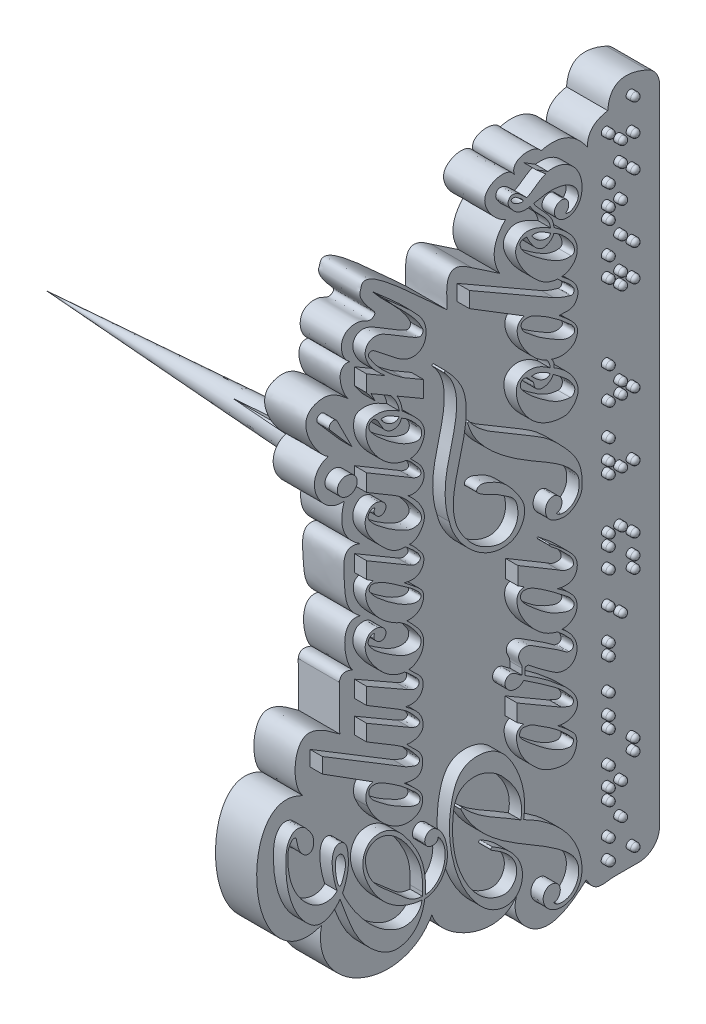
from build123d import *

# Parameters (mm, degrees)
SALIENTE_EXTRUIR2_DEPTH = 10
CORTAR_EXTRUIR1_DEPTH   = 141.50113099
CROQUIS5_RX             = 2.494776264
CROQUIS5_RY             = 2.162564658
SALIENTE_EXTRUIR3_DEPTH = 3
REDONDEO1_R             = 5
CROQUIS6_R              = 1
CROQUIS6_R_2            = 0.964072929
SALIENTE_EXTRUIR4_DEPTH = 2
REDONDEO2_R             = 0.9


with BuildPart() as part:
    # Croquis1 → Saliente-Extruir2 (new body)
    with BuildSketch(Plane.YZ):
        with BuildLine():
            Line((-82.644803295, -39.616041478), (-82.644803295, -50.4608464))
            Line((-82.644803295, -50.4608464), (81.390913247, -50.4608464))
            add(Edge.make_bspline(
                [(79.112679627, -37.887334346), (88.057990338, -38.615611944), (81.390913247, -50.4608464)],
                knots=[0, 0, 0, 1, 1, 1], degree=2))
            add(Edge.make_bspline(
                [(73.93771432, -32.938932182), (78.315794207, -32.933493174), (79.112679627, -37.887334346)],
                knots=[0, 0, 0, 1, 1, 1], degree=2))
            add(Edge.make_bspline(
                [(78.765086611, -21.726024385), (80.523803994, -28.350165455), (73.93771432, -32.938932182)],
                knots=[0, 0, 0, 1, 1, 1], degree=2))
            add(Edge.make_bspline(
                [(76.891946469, -15.280433308), (77.831036524, -14.90475999), (80.744878088, -15.427030243), (80.582437597, -20.589571644), (78.765086611, -21.726024385)],
                knots=[0.033422958, 0.033422958, 0.033422958, 0.033422958, 0.278906558, 1, 1, 1, 1], degree=3))
            add(Edge.make_bspline(
                [(68.678082118, -13.114016766), (69.381704581, -10.765136722), (75.473437831, -5.470496855), (79.073590292, -11.585310343), (78.232629186, -14.551405217), (76.891946469, -15.280433308)],
                knots=[0, 0, 0, 0, 0.533809886, 0.7593793, 0.979688772, 0.979688772, 0.979688772, 0.979688772], degree=3))
            add(Edge.make_bspline(
                [(58.024258387, -11.665002778), (63.926743781, -8.38634616), (68.678082118, -13.114016766)],
                knots=[0, 0, 0, 1, 1, 1], degree=2))
            Line((58.024258387, -11.665002778), (62.536415194, -4.977777268))
            add(Edge.make_bspline(
                [(56.821282934, 1.178760462), (59.424119549, 0.885336372), (68.466634263, 2.837578441), (62.536415194, -4.977777268)],
                knots=[0, 0, 0, 0, 1, 1, 1, 1], degree=3))
            add(Edge.make_bspline(
                [(57.642197805, 24.574203993), (58.564910608, 26.541632819), (64.414691172, 28.083051915), (65.474534565, 22.223747662), (63.470754247, 19.782671968), (64.793874912, 18.320168144), (66.360044444, 19.859895488), (69.557152039, 22.31258306), (71.000628198, 22.385209621), (71.715008577, 21.887921708), (76.703111675, 21.839215336), (57.38267557, 1.986730482), (56.821282934, 1.178760462)],
                knots=[0, 0, 0, 0, 0.22865966, 0.372766973, 0.461769751, 0.486323838, 0.53403408, 0.642402537, 0.758615164, 0.782831021, 0.884561112, 1, 1, 1, 1], degree=3))
            add(Edge.make_bspline(
                [(50.035249536, 25.024797896), (51.24517925, 26.466444064), (58.668353931, 28.991149977), (57.642197805, 24.574203993)],
                knots=[0, 0, 0, 0, 1, 1, 1, 1], degree=3))
            add(Edge.make_bspline(
                [(40.403908215, 29.917633263), (40.875847375, 31.781465146), (51.196718605, 39.010176033), (54.14276007, 29.637794143), (51.415174501, 26.740054005), (50.035249536, 25.024797896)],
                knots=[0, 0, 0, 0, 0.54701621, 0.715016523, 1, 1, 1, 1], degree=3))
            add(Edge.make_bspline(
                [(29.05506422, 26.072922848), (28.195127036, 31.760565181), (38.092287577, 36.932662613), (40.403908215, 29.917633263)],
                knots=[0, 0, 0, 0, 1, 1, 1, 1], degree=3))
            add(Edge.make_bspline(
                [(18.123116536, 22.117049567), (21.970176915, 28.28446548), (29.05506422, 26.072922848)],
                knots=[0, 0, 0, 1, 1, 1], degree=2))
            add(Edge.make_bspline(
                [(2.97566816, 22.117049567), (5.594219985, 25.840795536), (10.950754435, 25.803643162), (19.998115396, 26.667324524), (18.123116536, 22.117049567)],
                knots=[0, 0, 0, 0, 0.550537259, 1, 1, 1, 1], degree=3))
            add(Edge.make_bspline(
                [(-7.459260376, 24.031715354), (-5.479036756, 25.960438615), (4.669600043, 27.832747815), (2.97566816, 22.117049567)],
                knots=[0, 0, 0, 0, 1, 1, 1, 1], degree=3))
            add(Edge.make_bspline(
                [(-8.48441488, 27.230754731), (-6.186445977, 26.983265619), (-7.459260376, 24.031715354)],
                knots=[0, 0, 0, 1, 1, 1], degree=2))
            Line((-8.48441488, 27.230754731), (-19.379751367, 27.150319013))
            add(Edge.make_bspline(
                [(-27.882389681, 36.064675199), (-26.87452804, 37.040906566), (-21.992225334, 38.775291693), (-11.878482386, 36.522080197), (-18.224343165, 28.720921788), (-19.379751367, 27.150319013)],
                knots=[0.077094233, 0.077094233, 0.077094233, 0.077094233, 0.266164137, 0.614207306, 1, 1, 1, 1], degree=3))
            add(Edge.make_bspline(
                [(-57.318303844, 31.57511779), (-59.660343625, 37.380025457), (-50.670929259, 49.586206605), (-25.704244241, 47.536485851), (-26.642679671, 38.365618766), (-27.882389681, 36.064675199)],
                knots=[0, 0, 0, 0, 0.354827004, 0.843229357, 0.974583692, 0.974583692, 0.974583692, 0.974583692], degree=3))
            add(Edge.make_bspline(
                [(-57.318303844, 31.57511779), (-71.605295015, 34.512953916), (-81.578005408, 12.18779291), (-68.541134118, 4.791691125)],
                knots=[0, 0, 0, 0, 1, 1, 1, 1], degree=3))
            add(Edge.make_bspline(
                [(-68.541134118, 4.791691125), (-75.107673828, 2.958235432), (-82.462557591, -11.699903896), (-74.415357121, -15.989675807)],
                knots=[0, 0, 0, 0, 1, 1, 1, 1], degree=3))
            add(Edge.make_bspline(
                [(-74.415357121, -15.989675807), (-78.368849698, -14.005934117), (-87.893570794, -20.946057176), (-83.605571087, -28.659309912), (-79.917794735, -32.690135227)],
                knots=[0, 0, 0, 0, 0.492525232, 1, 1, 1, 1], degree=3))
            add(Edge.make_bspline(
                [(-79.917794735, -32.690135227), (-84.152824136, -34.881535191), (-82.644803295, -36.940698922), (-82.644803295, -39.616041478)],
                knots=[0, 0, 0, 0, 1, 1, 1, 1], degree=3))
        make_face()
    extrude(amount=SALIENTE_EXTRUIR2_DEPTH)

    # Croquis3 → Revolución1 (revolve)
    with BuildSketch(Plane.ZX.offset(-0.626945024)):
        Polygon((-11.665002778, 0), (-11.665002778, -100), (-5.665002778, 0), align=None)
    revolve(axis=Axis((0, -0.626945024, -11.665002778), (-1, 0, 0)))

    # Croquis4 → Cortar-Extruir1 (cut, through all)
    with BuildSketch(Plane(origin=(0, 0, 0), x_dir=(0, -1, 0), z_dir=(-1, 0, 0))):
        with BuildLine():
            Line((2.626945024, -17.321857027), (2.626945024, -13.665002778))
            Line((2.626945024, -13.665002778), (6.283799273, -13.665002778))
            ThreePointArc((6.283799273, -13.665002778), (4.869585711, -15.907643465), (2.626945024, -17.321857027))
        make_face()
        with BuildLine():
            Line((2.626945024, -6.008148528), (2.626945024, -9.665002778))
            Line((2.626945024, -9.665002778), (6.283799273, -9.665002778))
            ThreePointArc((6.283799273, -9.665002778), (4.869585711, -7.422362091), (2.626945024, -6.008148528))
        make_face()
        with BuildLine():
            Line((-1.373054976, -17.321857027), (-1.373054976, -13.665002778))
            Line((-1.373054976, -13.665002778), (-5.029909226, -13.665002778))
            ThreePointArc((-5.029909226, -13.665002778), (-3.615695663, -15.907643465), (-1.373054976, -17.321857027))
        make_face()
        with BuildLine():
            Line((-1.373054976, -6.008148528), (-1.373054976, -9.665002778))
            Line((-1.373054976, -9.665002778), (-5.029909226, -9.665002778))
            ThreePointArc((-5.029909226, -9.665002778), (-3.615695663, -7.422362091), (-1.373054976, -6.008148528))
        make_face()
    extrude(amount=CORTAR_EXTRUIR1_DEPTH, mode=Mode.SUBTRACT)

    # Croquis5 → Saliente-Extruir3 (add)
    # profile 1 of 9: a face of its own
    with BuildSketch(Plane.YZ.offset(10)):
        with Locations(Location((34.846843284, 28.332601043), (0, 0, 59.644295628))):
            Ellipse(CROQUIS5_RX, CROQUIS5_RY)
    # profile 2 of 9: a face of its own
    with BuildSketch(Plane.YZ.offset(10)):
        with BuildLine():
            Line((-30.497706307, 22.0410929), (-22.687780948, 34.378247684))
            Line((-22.687780948, 34.378247684), (-18.998784908, 34.378247684))
            Line((-18.998784908, 34.378247684), (-31.243112192, 14.206503376))
            add(Edge.make_bspline(
                [(-31.243112192, 14.206503376), (-31.495350477, 13.79095697), (-31.78046482, 12.824414388), (-32.380534398, 11.718420857), (-31.93997878, 10.715997927), (-31.011742933, 10.825491666), (-30.120200935, 11.573404961), (-28.02390287, 13.199131659), (-26.576148271, 14.855333875), (-25.670373492, 16.364958506)],
                knots=[0, 0, 0, 0, 0.125391882, 0.242084655, 0.298962532, 0.348525165, 0.442222819, 0.58819335, 1, 1, 1, 1], degree=3))
            Line((-25.670373492, 16.364958506), (-21.314218593, 23.625216671))
            Line((-21.314218593, 23.625216671), (-17.38975472, 23.625216671))
            Line((-17.38975472, 23.625216671), (-23.492296043, 13.14689813))
            add(Edge.make_bspline(
                [(-23.492296043, 13.14689813), (-23.709194259, 12.574873551), (-24.419922234, 11.748993625), (-23.711396026, 10.549508004), (-22.704430131, 11.070334517), (-20.833268788, 12.679925539), (-19.60177153, 13.727286494), (-18.260022215, 15.955299296)],
                knots=[0, 0, 0, 0, 0.194852855, 0.255549272, 0.32801945, 0.466069413, 1, 1, 1, 1], degree=3))
            Line((-18.260022215, 15.955299296), (-13.641060252, 23.625216671))
            Line((-13.641060252, 23.625216671), (-9.618093381, 23.625216671))
            Line((-9.618093381, 23.625216671), (-15.397904784, 13.483007356))
            add(Edge.make_bspline(
                [(-15.397904784, 13.483007356), (-15.632802368, 12.975963867), (-16.414408889, 11.849752088), (-15.438799291, 10.744805694), (-14.193984827, 11.115896775), (-12.956073494, 12.551207343), (-11.738337239, 13.604049866), (-11.195068735, 14.496009166)],
                knots=[0, 0, 0, 0, 0.25234893, 0.329617449, 0.447788217, 0.63904901, 1, 1, 1, 1], degree=3))
            add(Edge.make_bspline(
                [(-11.195068735, 14.496009166), (-11.125662358, 15.812887606), (-9.811063847, 18.799369933), (-6.291046383, 21.994014384), (-2.971777195, 23.938377405), (-0.761680135, 23.99547712), (0.152848159, 23.666337614), (1.064452528, 23.138362745), (1.437307684, 22.062885621), (1.462266794, 20.889925717), (0.866239543, 19.731265668), (0.033250535, 19.027722372), (-0.862524308, 18.899526658), (-1.728425228, 19.194985519), (-1.963550445, 20.255965684), (-1.256565159, 21.500243455), (-0.239431214, 22.215640374), (0.569327696, 21.649668078)],
                knots=[0, 0, 0, 0, 0.142885417, 0.345561827, 0.516919821, 0.5440803, 0.58436602, 0.62283742, 0.653405403, 0.704139129, 0.747462376, 0.792556118, 0.816847981, 0.844533108, 0.884115202, 0.91522998, 1, 1, 1, 1], degree=3))
            add(Edge.make_bspline(
                [(0.569327696, 21.649668078), (0.703885905, 22.173333667), (0.365145934, 23.047224893), (-0.873332324, 23.401697926), (-1.832397079, 22.734104907), (-3.164927941, 21.657374015), (-4.517845701, 19.854084499), (-6.14767733, 17.388414673), (-7.656944751, 14.917191894), (-8.250930214, 12.62010045), (-8.080206377, 10.6436884), (-6.226916701, 10.219628161), (-3.516466158, 12.025935037), (-1.468106793, 13.629987398), (-0.308113366, 15.512058678)],
                knots=[0, 0, 0, 0, 0.059858486, 0.084589238, 0.133112302, 0.178045114, 0.27869413, 0.378635457, 0.509425428, 0.593264141, 0.648482215, 0.700591929, 0.767969696, 1, 1, 1, 1], degree=3))
            add(Edge.make_bspline(
                [(-0.308113366, 15.512058678), (0.482389719, 17.271679063), (2.303957452, 20.015408618), (5.683196223, 22.691678255), (8.980556338, 24.078713978), (11.574226001, 23.924686296), (11.769595142, 22.0410929)],
                knots=[0, 0, 0, 0, 0.349520857, 0.588758676, 0.76777847, 1, 1, 1, 1], degree=3))
            Line((11.769595142, 22.0410929), (12.818282573, 23.625216671))
            Line((12.818282573, 23.625216671), (16.773332314, 23.625216671))
            Line((16.773332314, 23.625216671), (10.601057719, 13.14689813))
            add(Edge.make_bspline(
                [(10.601057719, 13.14689813), (10.403309376, 12.811192047), (9.854874697, 11.835880973), (10.466731922, 10.293676131), (11.907841206, 10.947491622), (13.245425571, 12.19234149), (14.370663516, 13.379217003), (15.013539455, 14.206503376)],
                knots=[0, 0, 0, 0, 0.18998974, 0.314253281, 0.46099557, 0.619369845, 1, 1, 1, 1], degree=3))
            add(Edge.make_bspline(
                [(15.013539455, 14.206503376), (14.861501424, 16.752595789), (17.513295191, 19.693311512), (21.04066715, 22.782156934), (23.933753673, 24.147587322), (26.481374878, 23.897348737), (27.953093696, 22.307998455), (27.723040651, 20.388237857), (26.744310064, 18.914610068), (24.875111847, 18.882332173), (24.322592807, 20.397600203), (25.23436895, 21.615835783), (26.262273059, 22.094216138), (26.881404862, 21.559220676)],
                knots=[0, 0, 0, 0, 0.257469456, 0.404494229, 0.516094308, 0.593903676, 0.669354812, 0.720453638, 0.795977604, 0.83917126, 0.895118555, 0.925933874, 1, 1, 1, 1], degree=3))
            add(Edge.make_bspline(
                [(26.881404862, 21.559220676), (27.095434819, 22.024707408), (26.903598025, 22.929151083), (25.595701402, 23.462917239), (24.34128487, 22.587136012), (23.172170991, 21.441882357), (21.057192441, 18.744302023), (18.990864201, 15.657862613), (17.652008916, 12.210035503), (18.504955327, 10.197354175), (20.099824322, 10.389866914), (21.242953044, 11.100089923), (23.800625982, 13.016208038), (25.938452498, 14.890218682), (27.017893445, 16.711662617)],
                knots=[0, 0, 0, 0, 0.049092218, 0.083265275, 0.127240511, 0.194236149, 0.257103548, 0.479655366, 0.581588916, 0.628504236, 0.66870028, 0.725490084, 0.77063452, 1, 1, 1, 1], degree=3))
            Line((27.017893445, 16.711662617), (31.115067776, 23.625216671))
            Line((31.115067776, 23.625216671), (35.257266001, 23.625216671))
            Line((35.257266001, 23.625216671), (28.696050361, 12.553850085))
            add(Edge.make_bspline(
                [(28.696050361, 12.553850085), (28.421001775, 12.38558581), (27.688811429, 10.302584809), (29.534538965, 10.561449842), (30.964216072, 11.881738568), (32.432103988, 12.9727037), (33.069573852, 14.025882844)],
                knots=[0, 0, 0, 0, 0.260800607, 0.352343484, 0.552856667, 1, 1, 1, 1], degree=3))
            add(Edge.make_bspline(
                [(33.069573852, 14.025882844), (33.409827481, 16.992613594), (36.389951401, 20.872947406), (41.20957219, 23.598047558), (44.131573279, 23.908158354), (46.010391398, 23.411691703), (46.752605622, 19.960019902), (45.511796067, 17.692317483), (44.307537822, 15.695233012)],
                knots=[0, 0, 0, 0, 0.340661798, 0.543870138, 0.625452295, 0.689244272, 0.744404401, 1, 1, 1, 1], degree=3))
            add(Edge.make_bspline(
                [(44.307537822, 15.695233012), (46.739800731, 16.14062036), (48.596886104, 17.817680667)],
                knots=[0, 0, 0, 1, 1, 1], degree=2))
            Line((48.596886104, 17.817680667), (51.37039432, 22.592218674))
            Line((51.37039432, 22.592218674), (49.327409213, 21.559220676))
            Line((49.327409213, 21.559220676), (52.08179092, 23.625216671))
            Line((52.08179092, 23.625216671), (56.040074566, 23.625216671))
            Line((56.040074566, 23.625216671), (53.377765451, 19.042105657))
            add(Edge.make_bspline(
                [(53.377765451, 19.042105657), (54.917231198, 20.83701878), (57.097396288, 23.246568199), (60.849365024, 24.232211253), (62.812996414, 23.15197918), (63.059472624, 20.708912494), (61.646210479, 18.233281197), (59.944700362, 15.468199939), (58.458594129, 13.043884123), (57.614839954, 11.47508115), (57.201618374, 10.151887113), (58.379948137, 9.767346828), (58.757349247, 10.061457871)],
                knots=[0, 0, 0, 0, 0.271834595, 0.349441849, 0.418952217, 0.493831227, 0.597398699, 0.73563194, 0.864555428, 0.912431867, 0.945486453, 1, 1, 1, 1], degree=3))
            add(Edge.make_bspline(
                [(58.757349247, 10.061457871), (63.129690422, 12.126338427), (65.890042563, 16.349596698), (69.639244247, 19.24270502)],
                knots=[0, 0, 0, 0, 1, 1, 1, 1], degree=3))
            add(Edge.make_bspline(
                [(50.784198361, 14.696456585), (52.083335439, 16.665281832), (54.754997349, 19.863668839), (57.583549019, 22.009907803), (59.867790785, 23.622580383), (60.343395815, 22.546045741), (59.983709006, 21.657106373), (58.89108044, 20.410563913), (56.886609035, 17.632506907), (54.337885956, 15.031926684), (53.850630468, 11.798154204), (55.041008394, 9.290230184), (59.260948676, 8.825606098), (64.385462227, 12.744249261), (67.265776169, 16.731441217), (69.639244247, 19.24270502)],
                knots=[0, 0, 0, 0, 0.165295197, 0.229847239, 0.273783251, 0.283531385, 0.295769431, 0.332828834, 0.390387274, 0.517595279, 0.555803585, 0.593627198, 0.683261048, 0.778170359, 1, 1, 1, 1], degree=3))
            Line((50.784198361, 14.696456585), (47.926779005, 9.777467258))
            Line((47.926779005, 9.777467258), (43.92636135, 9.777467258))
            Line((43.92636135, 9.777467258), (47.70798914, 16.287462615))
            add(Edge.make_bspline(
                [(43.92636135, 15.001683932), (45.979958164, 15.159350298), (47.70798914, 16.287462615)],
                knots=[0, 0, 0, 1, 1, 1], degree=2))
            add(Edge.make_bspline(
                [(32.955522845, 13.064949631), (32.853955645, 10.948475602), (38.411901674, 7.341171787), (42.317267568, 13.415106695), (43.92636135, 15.001683932)],
                knots=[0, 0, 0, 0, 0.387764521, 1, 1, 1, 1], degree=3))
            add(Edge.make_bspline(
                [(25.519528041, 13.710651274), (24.828449868, 12.537129382), (25.525168279, 9.786549722), (29.909740771, 9.481667437), (31.67224914, 11.884750717), (32.955522845, 13.064949631)],
                knots=[0, 0, 0, 0, 0.341873527, 0.528237882, 1, 1, 1, 1], degree=3))
            add(Edge.make_bspline(
                [(15.013539455, 13.311144091), (14.91429186, 11.925781845), (16.343656626, 10.332155077), (18.912958232, 9.383184268), (22.250934954, 10.368843224), (24.204621252, 12.246617966), (25.519528041, 13.710651274)],
                knots=[0, 0, 0, 0, 0.276982541, 0.422942082, 0.57202269, 1, 1, 1, 1], degree=3))
            add(Edge.make_bspline(
                [(7.561671932, 14.496009166), (7.267676701, 13.48275104), (6.912069425, 11.098654317), (9.182991117, 9.734650211), (11.078164452, 9.68719222), (12.952699416, 11.230951911), (14.311638939, 12.309064024), (15.013539455, 13.311144091)],
                knots=[0, 0, 0, 0, 0.28826711, 0.445397221, 0.571943816, 0.717435638, 1, 1, 1, 1], degree=3))
            add(Edge.make_bspline(
                [(-0.694878283, 13.902170657), (-0.934340159, 12.794224493), (-0.452231084, 10.765849124), (1.618946089, 9.7936436), (2.847764132, 9.749983221), (3.862615372, 10.149224275), (5.493022345, 11.666220656), (6.537569955, 13.349788418), (7.561671932, 14.496009166)],
                knots=[0, 0, 0, 0, 0.26750859, 0.402148969, 0.498610503, 0.541616972, 0.649788603, 1, 1, 1, 1], degree=3))
            add(Edge.make_bspline(
                [(-11.195068735, 13.311144091), (-11.178625535, 12.614098786), (-10.610030803, 11.404395217), (-9.266733899, 10.200024497), (-7.742074453, 9.763986285), (-4.407040998, 9.78892671), (-2.238831965, 12.469594053), (-0.694878283, 13.902170657)],
                knots=[0, 0, 0, 0, 0.148996016, 0.285512453, 0.380610203, 0.491113446, 1, 1, 1, 1], degree=3))
            add(Edge.make_bspline(
                [(-18.651058208, 14.206503376), (-18.89847325, 13.208950869), (-18.943961216, 11.197959644), (-16.906331206, 9.846097911), (-13.827040536, 9.880954987), (-12.461609436, 12.402679974), (-11.195068735, 13.311144091)],
                knots=[0, 0, 0, 0, 0.281685785, 0.41294428, 0.576334414, 1, 1, 1, 1], degree=3))
            add(Edge.make_bspline(
                [(-26.669974615, 13.902170657), (-26.951551347, 12.907685136), (-26.614477477, 9.793952995), (-21.737710067, 9.959672558), (-19.92790384, 12.554520228), (-18.651058208, 14.206503376)],
                knots=[0, 0, 0, 0, 0.313935981, 0.487109169, 1, 1, 1, 1], degree=3))
            add(Edge.make_bspline(
                [(-34.612788223, 14.406680678), (-34.749578709, 13.498311973), (-35.462920373, 10.853012022), (-32.831918615, 9.913102922), (-29.639536103, 10.176666048), (-28.068462248, 12.824410423), (-26.669974615, 13.902170657)],
                knots=[0, 0, 0, 0, 0.278767773, 0.418047709, 0.56300297, 1, 1, 1, 1], degree=3))
            add(Edge.make_bspline(
                [(-41.665402261, 18.06000394), (-42.398649629, 16.939800513), (-43.38983181, 15.00218828), (-43.245492069, 12.154322453), (-41.878669651, 10.056375276), (-39.162522446, 9.858245633), (-36.854296577, 11.850247578), (-35.525473694, 13.391655238), (-34.612788223, 14.406680678)],
                knots=[0, 0, 0, 0, 0.236613525, 0.362100544, 0.48321998, 0.639456455, 0.763525568, 1, 1, 1, 1], degree=3))
            add(Edge.make_bspline(
                [(-41.665402261, 18.06000394), (-38.976789167, 21.692281799), (-34.885731766, 23.433851877)],
                knots=[0, 0, 0, 1, 1, 1], degree=2))
            add(Edge.make_bspline(
                [(-34.885731766, 23.433851877), (-34.090598621, 23.751499954), (-32.311132142, 24.056793618), (-30.572042521, 23.183195618), (-30.497706307, 22.0410929)],
                knots=[0, 0, 0, 0, 0.485787736, 1, 1, 1, 1], degree=3))
        make_face()
        with BuildLine():
            add(Edge.make_bspline(
                [(-40.447564124, 12.172364936), (-40.18129702, 13.179955863), (-39.14482847, 14.93934801), (-37.666461097, 17.851893592), (-35.432747972, 20.608407645), (-33.731351433, 23.132126269), (-31.751757451, 23.100654241), (-31.282712559, 22.56918234), (-31.085075052, 21.370533187), (-31.886399111, 19.548776174), (-33.392033254, 17.233904327), (-35.082362201, 14.748183847), (-37.09405979, 12.605250295), (-38.464665179, 10.999519338), (-39.814486027, 10.524672569), (-40.694613408, 10.960918218), (-40.576500257, 11.684453077), (-40.447564124, 12.172364936)],
                knots=[0, 0, 0, 0, 0.085966306, 0.206460373, 0.292539348, 0.428730708, 0.447980431, 0.464095345, 0.4900801, 0.557009165, 0.641477484, 0.750478217, 0.835345127, 0.916018946, 0.945475368, 0.958372015, 1, 1, 1, 1], degree=3))
        make_face(mode=Mode.SUBTRACT)
        with BuildLine():
            add(Edge.make_bspline(
                [(10.933520233, 21.260937611), (11.026943852, 21.510852075), (11.185293923, 21.982797903), (11.088155124, 22.782409299), (10.294540528, 23.139165812), (9.566572567, 22.736511922), (8.208035994, 21.70060739), (6.129496236, 19.288265116), (3.766195356, 16.04441155), (2.279766755, 13.07196994), (1.911891265, 11.198784452), (2.438533315, 10.378860583), (3.296005178, 10.44245619), (3.984188127, 11.050238741), (4.595548889, 11.722516623), (5.591897927, 12.741557684), (7.646231694, 15.924145112), (10.011124132, 18.793465993), (10.933520233, 21.260937611)],
                knots=[0, 0, 0, 0, 0.025213843, 0.046911913, 0.068040733, 0.094659768, 0.119728721, 0.230589651, 0.389513283, 0.497031106, 0.541805392, 0.563227914, 0.573881123, 0.617524423, 0.644483831, 0.660275178, 0.751057055, 1, 1, 1, 1], degree=3))
        make_face(mode=Mode.SUBTRACT)
        with BuildLine():
            add(Edge.make_bspline(
                [(43.064694075, 15.695233012), (43.705202044, 17.043104096), (45.147793787, 18.494536691), (44.801862268, 20.168439644)],
                knots=[0, 0, 0, 0, 1, 1, 1, 1], degree=3))
            add(Edge.make_bspline(
                [(44.801862268, 20.168439644), (44.054757212, 19.801378341), (42.798120456, 18.519016329), (42.178396667, 16.511825406), (43.064694075, 15.695233012)],
                knots=[0, 0, 0, 0, 0.443860442, 1, 1, 1, 1], degree=3))
        make_face(mode=Mode.SUBTRACT)
        with BuildLine():
            add(Edge.make_bspline(
                [(42.524103437, 15.18353356), (41.106910436, 15.487936036), (40.676057715, 17.841216537), (42.90403015, 20.119343708), (44.713605701, 20.646318096), (45.538393761, 21.649668078)],
                knots=[0, 0, 0, 0, 0.390263784, 0.598106042, 1, 1, 1, 1], degree=3))
            add(Edge.make_bspline(
                [(45.538393761, 21.649668078), (45.687915256, 22.052098007), (45.509388179, 22.833550146), (44.216615328, 23.281393493), (42.867983039, 22.329081693), (40.579870517, 20.161261894), (38.0541568, 16.814292594), (36.218293317, 13.665329329), (35.457692022, 10.211337619), (37.734633049, 10.213137819), (39.96404805, 11.849917195), (41.635297917, 13.510948417), (42.524103437, 15.18353356)],
                knots=[0, 0, 0, 0, 0.048158976, 0.074574605, 0.142627086, 0.215099305, 0.445178577, 0.592364676, 0.678170068, 0.744904986, 0.783215905, 1, 1, 1, 1], degree=3))
        make_face(mode=Mode.SUBTRACT)
    # profile 3 of 9: a face of its own
    with BuildSketch(Plane.YZ.offset(10)):
        with BuildLine():
            Line((-36.589142617, -14.473064038), (-35.530540616, -12.904764777))
            Line((-35.530540616, -12.904764777), (-31.394151315, -12.904764777))
            Line((-31.394151315, -12.904764777), (-37.667348359, -23.686822196))
            add(Edge.make_bspline(
                [(-37.667348359, -23.686822196), (-37.541190488, -23.883626797), (-39.212442592, -26.153133263), (-37.725537473, -26.65675328), (-36.754460843, -26.251167565), (-35.267603298, -24.922469019), (-33.190929851, -22.906433336), (-30.544177434, -18.998088893), (-28.964553076, -16.92825523), (-27.42825413, -14.473064038)],
                knots=[0, 0, 0, 0, 0.14525193, 0.175575069, 0.204105069, 0.303646465, 0.478715982, 0.653344411, 1, 1, 1, 1], degree=3))
            add(Edge.make_bspline(
                [(-27.42825413, -14.473064038), (-27.949733257, -14.07647141), (-28.462528668, -12.955697255), (-28.055160164, -11.155885197), (-26.870971735, -10.01510621), (-25.352193168, -9.821781298), (-24.402536135, -10.743334805), (-24.557902066, -11.893839044), (-25.284864236, -12.919550549), (-25.869138437, -13.612721811), (-26.155415148, -14.114735935)],
                knots=[0, 0, 0, 0, 0.168279773, 0.299868444, 0.462898237, 0.570080625, 0.670079551, 0.761042164, 0.848906487, 1, 1, 1, 1], degree=3))
            Line((-26.155415148, -14.114735935), (-24.696137457, -14.114735935))
            add(Edge.make_bspline(
                [(-24.696137457, -14.114735935), (-23.78203047, -14.110158411), (-22.860187076, -13.123902106), (-20.822720068, -13.314740071), (-20.320673596, -15.196047406), (-21.481186737, -17.131276785), (-23.519173304, -20.090566217), (-25.186564446, -23.049823123), (-27.005579737, -25.216448441), (-26.682205791, -26.69905747), (-24.846058273, -26.393381504), (-23.314659625, -24.855582792), (-21.96912491, -23.512615862), (-21.314218593, -22.675786924)],
                knots=[0, 0, 0, 0, 0.100494216, 0.148461896, 0.209389559, 0.289545911, 0.40953298, 0.637589615, 0.695543286, 0.734759354, 0.779003548, 0.87302752, 1, 1, 1, 1], degree=3))
            add(Edge.make_bspline(
                [(-21.314218593, -22.675786924), (-20.662718094, -19.74721257), (-17.729032764, -16.352078884), (-13.38279486, -13.64508377), (-10.204239491, -12.635955653), (-7.921858441, -12.910678267), (-7.873240841, -14.671315572)],
                knots=[0, 0, 0, 0, 0.462898307, 0.689315778, 0.804550276, 1, 1, 1, 1], degree=3))
            Line((-7.873240841, -14.671315572), (-6.825426111, -13.047202742))
            Line((-6.825426111, -13.047202742), (-2.564312878, -13.047202742))
            Line((-2.564312878, -13.047202742), (-8.523103919, -23.059368665))
            add(Edge.make_bspline(
                [(-8.523103919, -23.059368665), (-9.113764747, -23.907907811), (-9.764832497, -25.079563624), (-9.283466593, -26.61865014), (-8.359175348, -26.55060604), (-7.6741872, -26.252401621), (-6.711400797, -25.606922583), (-5.829417747, -24.550550046), (-4.475199698, -23.367917875), (-3.431711699, -22.156339789), (-2.727787436, -21.09912143), (-2.237647188, -20.801852808)],
                knots=[0, 0, 0, 0, 0.244457244, 0.274609225, 0.337331503, 0.412324183, 0.497476135, 0.582172537, 0.73631932, 0.868933802, 1, 1, 1, 1], degree=3))
            add(Edge.make_bspline(
                [(-2.237647188, -20.801852808), (-2.157651198, -20.753335475), (-2.050003553, -20.709749878), (-1.940536131, -20.877484589), (-2.016763136, -20.977203469)],
                knots=[0, 0, 0, 0, 0.447969714, 1, 1, 1, 1], degree=3))
            add(Edge.make_bspline(
                [(-12.283196994, -22.675786924), (-12.52744865, -23.721936247), (-13.008019338, -26.389432927), (-10.097803732, -27.747888735), (-7.540451292, -27.116252742), (-5.443855141, -25.071433504), (-3.584529966, -22.973522383), (-2.458703448, -21.555342317), (-2.016763136, -20.977203469)],
                knots=[0, 0, 0, 0, 0.227561632, 0.360002103, 0.497208089, 0.676097305, 0.870838032, 1, 1, 1, 1], degree=3))
            add(Edge.make_bspline(
                [(-21.314218593, -23.686822196), (-21.456986689, -24.908478157), (-20.416576355, -27.444173334), (-17.111684702, -27.566500486), (-14.456457303, -25.759622556), (-13.189579667, -24.04932219), (-12.283196994, -22.675786924)],
                knots=[0, 0, 0, 0, 0.287522083, 0.498789886, 0.650604314, 1, 1, 1, 1], degree=3))
            add(Edge.make_bspline(
                [(-24.81525406, -15.672488767), (-26.060219591, -17.090042713), (-27.872930685, -19.823307792), (-30.66885256, -23.331281046), (-29.979567981, -26.457421917), (-26.152314548, -28.607888661), (-22.540504943, -25.48937093), (-21.314218593, -23.686822196)],
                knots=[0, 0, 0, 0, 0.247621329, 0.466641638, 0.549743373, 0.643825708, 1, 1, 1, 1], degree=3))
            add(Edge.make_bspline(
                [(-25.060829882, -14.760903798), (-24.670997452, -14.760903798), (-24.718820119, -15.644128314), (-24.81525406, -15.672488767)],
                knots=[0, 0, 0, 0, 1, 1, 1, 1], degree=3))
            Line((-25.060829882, -14.760903798), (-26.545208314, -14.760903798))
            add(Edge.make_bspline(
                [(-32.783090485, -23.309419323), (-30.389643163, -20.70670642), (-28.382832279, -17.773119621), (-26.545208314, -14.760903798)],
                knots=[0, 0, 0, 0, 1, 1, 1, 1], degree=3))
            add(Edge.make_bspline(
                [(-41.027553368, -22.675786924), (-41.625501514, -23.910000001), (-41.220899702, -27.521338633), (-36.699337674, -27.814866835), (-33.489396872, -24.289216747), (-32.783090485, -23.309419323)],
                knots=[0, 0, 0, 0, 0.339105449, 0.559776115, 1, 1, 1, 1], degree=3))
            add(Edge.make_bspline(
                [(-46.670259924, -16.916089347), (-48.519142541, -18.691307093), (-49.914492909, -21.40140644), (-50.282880918, -26.038716892), (-47.773762667, -27.470856673), (-45.250454965, -27.456025326), (-43.155012447, -25.206532006), (-41.828283406, -23.805264459), (-41.027553368, -22.675786924)],
                knots=[0, 0, 0, 0, 0.336873126, 0.480562729, 0.576285296, 0.713907814, 0.806228155, 1, 1, 1, 1], degree=3))
            add(Edge.make_bspline(
                [(-46.670259924, -16.916089347), (-44.732122721, -14.896395878), (-41.623506711, -12.729377856), (-36.876007668, -12.522450193), (-36.589142617, -14.473064038)],
                knots=[0, 0, 0, 0, 0.651483923, 1, 1, 1, 1], degree=3))
        make_face()
        with BuildLine():
            add(Edge.make_bspline(
                [(-46.978820231, -25.249744012), (-46.805118283, -24.203334809), (-45.664824752, -21.415236997), (-42.894653506, -17.876101562), (-40.541550301, -14.986812095), (-38.666338389, -13.143007551), (-37.171421755, -13.927612398), (-37.429529282, -15.137891914), (-37.591059372, -16.422419201), (-38.923578302, -18.157975502), (-40.303182966, -20.594541312), (-42.501986631, -23.479403797), (-44.345137661, -25.387036228), (-46.007224424, -26.826929376), (-47.09654746, -26.173694117), (-47.025192657, -25.529099162), (-46.978820231, -25.249744012)],
                knots=[0, 0, 0, 0, 0.090530315, 0.274154443, 0.387080475, 0.44561956, 0.476897129, 0.505931909, 0.544194431, 0.59498319, 0.694927298, 0.798763293, 0.913403487, 0.945966019, 0.97583153, 1, 1, 1, 1], degree=3))
        make_face(mode=Mode.SUBTRACT)
        with BuildLine():
            add(Edge.make_bspline(
                [(-17.944750921, -24.175669534), (-17.497455223, -22.9786373), (-16.491157201, -20.705970045), (-14.228574058, -17.825932415), (-12.1707091, -15.421444038), (-10.586479042, -13.881737303), (-9.233583139, -13.586303983), (-8.620931552, -14.11766229), (-8.50559312, -15.202747719), (-9.187393392, -17.020671897), (-10.644525774, -19.105221558), (-12.320774632, -21.545179426), (-14.282044728, -24.003382794), (-15.804053235, -26.149175019), (-17.529428031, -26.825068213), (-18.118533344, -26.536711294), (-18.444313588, -25.580590052), (-18.17397857, -24.789118057), (-17.944750921, -24.175669534)],
                knots=[0, 0, 0, 0, 0.11090409, 0.224900591, 0.32275164, 0.396740853, 0.416178397, 0.439155655, 0.458588129, 0.510413627, 0.607683339, 0.686284643, 0.77421757, 0.890306213, 0.914591937, 0.928991008, 0.943164479, 1, 1, 1, 1], degree=3))
        make_face(mode=Mode.SUBTRACT)
    # profile 4 of 9: a face of its own
    with BuildSketch(Plane.YZ.offset(10)):
        with BuildLine():
            Line((49.064493096, -14.671315572), (57.290510702, -1.311163425))
            Line((57.290510702, -1.311163425), (61.100100823, -1.311163425))
            Line((61.100100823, -1.311163425), (49.327409213, -21.808781068))
            add(Edge.make_bspline(
                [(49.327409213, -21.808781068), (48.339098786, -23.700659474), (47.811733476, -25.757381001)],
                knots=[0, 0, 0, 1, 1, 1], degree=2))
            add(Edge.make_bspline(
                [(47.811733476, -25.757381001), (47.46771167, -26.448910509), (48.408088409, -26.953251647), (50.577765857, -25.711479158), (51.573342996, -23.855203115), (52.83297246, -22.675786924)],
                knots=[0, 0, 0, 0, 0.217033476, 0.277261483, 1, 1, 1, 1], degree=3))
            add(Edge.make_bspline(
                [(52.83297246, -22.675786924), (52.925264203, -20.11194608), (55.861769188, -16.55570042), (60.152371491, -13.393175886), (64.429103777, -11.931509576), (66.51904784, -14.189520628), (66.547367186, -17.375073345), (65.240390632, -19.39418659), (64.442769926, -20.977203469)],
                knots=[0, 0, 0, 0, 0.28484034, 0.494618585, 0.639607744, 0.741193806, 0.790470443, 1, 1, 1, 1], degree=3))
            add(Edge.make_bspline(
                [(64.442769926, -20.977203469), (67.445017457, -20.679343318), (68.832483189, -17.219234634), (71.404194247, -16.085406747)],
                knots=[0, 0, 0, 0, 1, 1, 1, 1], degree=3))
            add(Edge.make_bspline(
                [(71.404194247, -16.085406747), (71.133602513, -14.995691315), (71.368853976, -12.90344372), (73.20225775, -11.427487765), (74.614971385, -10.422548925), (76.052300761, -11.119275511), (75.949195908, -13.319566802), (74.387679505, -14.288436426), (73.662809556, -15.240915162)],
                knots=[0, 0, 0, 0, 0.266847528, 0.419625993, 0.539160831, 0.639185141, 0.706232267, 1, 1, 1, 1], degree=3))
            add(Edge.make_bspline(
                [(73.662809556, -15.240915162), (74.325660994, -16.904871781), (75.794769594, -18.093680135), (76.343193456, -19.832025065)],
                knots=[0, 0, 0, 0, 1, 1, 1, 1], degree=3))
            Line((76.343193456, -19.832025065), (78.356931487, -17.517658141))
            Line((78.356931487, -17.517658141), (76.608626298, -20.337353759))
            add(Edge.make_bspline(
                [(65.854104068, -24.779293655), (66.056473004, -25.20773205), (66.993298898, -25.560028648), (68.515647078, -25.191374475), (69.141233338, -23.684312269), (68.55987468, -22.391883657), (67.309944498, -21.700814998), (65.841847113, -22.294411805), (64.59594539, -23.664430421), (64.308006902, -26.08648017), (66.258692734, -28.315810012), (72.363384217, -29.411954971), (77.307822072, -25.284155519), (76.608626298, -20.337353759)],
                knots=[0, 0, 0, 0, 0.045053215, 0.090751648, 0.144418817, 0.182812034, 0.224475013, 0.273595313, 0.327678816, 0.406288058, 0.49277959, 0.596484506, 1, 1, 1, 1], degree=3))
            add(Edge.make_bspline(
                [(71.591354449, -16.916089347), (71.867996361, -18.162302092), (72.557545564, -21.342890082), (71.650185388, -25.939034631), (68.815914758, -27.728202305), (67.18499016, -27.849065773), (66.219415107, -27.033225412), (65.566987993, -26.217738909), (65.343078138, -25.409645012), (65.614550325, -24.531533675), (65.854104068, -24.779293655)],
                knots=[0, 0, 0, 0, 0.2158676, 0.586054762, 0.684876877, 0.784597528, 0.839918776, 0.897923489, 0.958698331, 1, 1, 1, 1], degree=3))
            add(Edge.make_bspline(
                [(64.094882406, -21.808781068), (67.303598452, -21.732758977), (69.073586627, -18.303974707), (71.591354449, -16.916089347)],
                knots=[0, 0, 0, 0, 1, 1, 1, 1], degree=3))
            add(Edge.make_bspline(
                [(52.83297246, -23.686822196), (52.844999346, -25.163120718), (54.364065578, -27.458626442), (59.861477705, -27.652119084), (62.578732259, -23.897720698), (64.094882406, -21.808781068)],
                knots=[0, 0, 0, 0, 0.288019607, 0.431178397, 1, 1, 1, 1], degree=3))
            add(Edge.make_bspline(
                [(44.977524237, -23.059368665), (44.958620581, -24.087157084), (44.441190253, -26.406158492), (46.880162118, -27.815262847), (50.1201209, -27.362088516), (51.722827371, -24.984367136), (52.83297246, -23.686822196)],
                knots=[0, 0, 0, 0, 0.27188574, 0.426640437, 0.570583027, 1, 1, 1, 1], degree=3))
            add(Edge.make_bspline(
                [(36.712930337, -21.221320049), (36.222926012, -22.406170454), (35.966301906, -24.362577782), (37.036622457, -26.688565714), (38.56324193, -27.576184324), (40.362680666, -27.592963397), (42.662432828, -26.009862561), (43.93417689, -24.249546015), (44.977524237, -23.059368665)],
                knots=[0, 0, 0, 0, 0.251228857, 0.359926586, 0.479127162, 0.572937462, 0.694875113, 1, 1, 1, 1], degree=3))
            add(Edge.make_bspline(
                [(34.617878492, -21.808781068), (35.830347239, -22.02459899), (36.712930337, -21.221320049)],
                knots=[0, 0, 0, 1, 1, 1], degree=2))
            add(Edge.make_bspline(
                [(23.169427538, -24.779293655), (23.632207201, -26.298207506), (25.939704349, -28.206117155), (30.889310536, -26.714271628), (33.277031639, -24.096837133), (34.617878492, -21.808781068)],
                knots=[0, 0, 0, 0, 0.327278207, 0.464117917, 1, 1, 1, 1], degree=3))
            add(Edge.make_bspline(
                [(23.169427538, -24.779293655), (23.033575958, -22.280398854), (24.422028529, -17.399156908), (29.421948578, -13.763081236), (33.230798172, -12.602074837), (35.846219612, -12.714809085), (38.058076433, -16.095183803), (36.24998595, -19.308084647), (35.045406439, -20.882686873)],
                knots=[0, 0, 0, 0, 0.264379004, 0.508658658, 0.615544944, 0.692031587, 0.763499805, 1, 1, 1, 1], degree=3))
            add(Edge.make_bspline(
                [(35.045406439, -20.882686873), (36.219294034, -20.879956768), (37.143364299, -20.059659713)],
                knots=[0, 0, 0, 1, 1, 1], degree=2))
            add(Edge.make_bspline(
                [(37.143364299, -20.059659713), (38.03205242, -17.942952491), (40.649695233, -15.406752815), (45.011576885, -12.889228741), (48.49529945, -12.499868937), (49.064493096, -14.671315572)],
                knots=[0, 0, 0, 0, 0.438047767, 0.676242914, 1, 1, 1, 1], degree=3))
        make_face()
        with BuildLine():
            add(Edge.make_bspline(
                [(39.218213717, -26.220402555), (38.997043826, -25.337115062), (39.519861414, -23.528504416), (40.948741654, -21.335321596), (42.471194377, -18.518718524), (44.44511767, -16.175052195), (46.019918659, -14.155120794), (48.038892866, -13.603912346), (48.584146057, -15.789338287), (47.682547827, -17.569511885), (45.605891227, -21.188688531), (43.220541681, -24.305177354), (40.851644209, -26.757820353), (39.47365355, -26.982611634), (39.266101278, -26.411651386), (39.218213717, -26.220402555)],
                knots=[0, 0, 0, 0, 0.077906853, 0.163792135, 0.23976646, 0.369498324, 0.439476838, 0.479179921, 0.521749531, 0.600376486, 0.663490542, 0.901985994, 0.949923444, 0.983131659, 1, 1, 1, 1], degree=3))
        make_face(mode=Mode.SUBTRACT)
        with BuildLine():
            add(Edge.make_bspline(
                [(73.388891191, -14.331158181), (73.163410493, -14.314512705), (73.444690428, -13.108175957), (73.813028887, -12.335457402), (74.373141163, -11.616148354), (75.102034306, -11.373269538), (75.254510079, -11.889765863), (75.189028746, -12.558506256), (74.43662927, -13.269990667), (74.057135158, -14.034150772), (73.475872507, -14.337579332), (73.388891191, -14.331158181)],
                knots=[0, 0, 0, 0, 0.134586907, 0.295458361, 0.446385028, 0.496870641, 0.561839385, 0.616173733, 0.783827645, 0.948081825, 1, 1, 1, 1], degree=3))
        make_face(mode=Mode.SUBTRACT)
        with BuildLine():
            add(Edge.make_bspline(
                [(26.408574498, -25.757381001), (26.467091978, -23.216909911), (28.586099861, -19.995056115), (31.307878063, -16.406598314), (33.08439515, -14.643160803), (34.290222455, -13.668886914), (35.271290317, -13.63937272), (35.973893531, -14.07573956), (36.029473162, -14.873996576), (35.600809339, -15.561228553), (34.805710576, -16.064646614), (34.325453567, -16.695819635), (33.964711944, -16.916089347)],
                knots=[0, 0, 0, 0, 0.369570371, 0.559837459, 0.675142358, 0.750596528, 0.780141105, 0.817699207, 0.862554196, 0.881991958, 0.937763747, 1, 1, 1, 1], degree=3))
            add(Edge.make_bspline(
                [(33.326722828, -21.633212257), (31.223285254, -20.895308866), (30.981819775, -16.941337392), (33.964711944, -16.916089347)],
                knots=[0, 0, 0, 0, 1, 1, 1, 1], degree=3))
            add(Edge.make_bspline(
                [(26.408574498, -25.757381001), (26.270198804, -26.521096469), (27.656305246, -27.247292671), (29.04263597, -26.281181208), (31.175917211, -24.798075025), (32.264834519, -22.875685988), (33.326722828, -21.633212257)],
                knots=[0, 0, 0, 0, 0.193156386, 0.359154681, 0.487732192, 1, 1, 1, 1], degree=3))
        make_face(mode=Mode.SUBTRACT)
        with BuildLine():
            add(Edge.make_bspline(
                [(33.832661674, -20.882686873), (34.420163111, -20.228695272), (35.286551081, -18.809962193), (35.68999048, -17.168679558), (35.517927468, -16.384334132)],
                knots=[0, 0, 0, 0, 0.529808729, 1, 1, 1, 1], degree=3))
            add(Edge.make_bspline(
                [(33.832661674, -20.882686873), (33.4666933, -20.75918017), (32.870316265, -18.873859515), (34.657725025, -17.248192473), (35.517927468, -16.384334132)],
                knots=[0, 0, 0, 0, 0.187950201, 1, 1, 1, 1], degree=3))
        make_face(mode=Mode.SUBTRACT)
        with BuildLine():
            add(Edge.make_bspline(
                [(56.040074566, -26.005727404), (55.854642007, -24.26526591), (57.205161736, -21.435675696), (59.624612691, -17.944022808), (61.759321213, -15.267797116), (63.484444574, -13.745064278), (65.423656917, -13.439860671), (65.401291678, -14.902136507), (65.332439494, -15.240915162)],
                knots=[0, 0, 0, 0, 0.285453613, 0.51181755, 0.723959996, 0.856919371, 0.908471523, 1, 1, 1, 1], degree=3))
            add(Edge.make_bspline(
                [(62.859501138, -21.808781068), (61.876762508, -21.478179843), (59.512121755, -18.174460089), (64.324003059, -15.720589367), (65.332439494, -15.240915162)],
                knots=[0, 0, 0, 0, 0.348085474, 1, 1, 1, 1], degree=3))
            add(Edge.make_bspline(
                [(56.040074566, -26.005727404), (56.078633041, -26.896841023), (57.802766906, -26.853050916), (60.326133785, -25.146354854), (62.097127265, -23.30963763), (62.859501138, -21.808781068)],
                knots=[0, 0, 0, 0, 0.199781249, 0.458675934, 1, 1, 1, 1], degree=3))
        make_face(mode=Mode.SUBTRACT)
        with BuildLine():
            add(Edge.make_bspline(
                [(63.332760534, -20.977203469), (64.215016956, -19.619971984), (65.45204769, -18.136766172), (65.009428652, -16.384334132)],
                knots=[0, 0, 0, 0, 1, 1, 1, 1], degree=3))
            add(Edge.make_bspline(
                [(63.332760534, -20.977203469), (62.758836936, -21.019632034), (62.407924961, -18.752928798), (63.719490674, -17.359148383), (65.009428652, -16.384334132)],
                knots=[0, 0, 0, 0, 0.221174546, 1, 1, 1, 1], degree=3))
        make_face(mode=Mode.SUBTRACT)
    # profile 5 of 9: a face of its own
    with BuildSketch(Plane.YZ.offset(10)):
        with BuildLine():
            Line((42.524103437, 27.179374625), (48.604604665, 32.471846877))
            ThreePointArc((48.604604665, 32.471846877), (50.116140753, 32.27131807), (49.728088141, 30.796744126))
            Line((49.728088141, 30.796744126), (42.524103437, 27.179374625))
        make_face()
    # profile 6 of 9: a face of its own
    with BuildSketch(Plane.YZ.offset(10)):
        with BuildLine():
            ThreePointArc((46.738282086, 4.707069642), (47.053485491, 4.694249436), (47.040665285, 4.37904603))
            add(Edge.make_bspline(
                [(8.807332264, -0.921877734), (9.922324649, 0.021502557), (12.119916708, 1.538436056), (15.904358055, 2.632495783), (20.274862182, 2.625030771), (25.339394973, 1.455182252), (30.411093214, 0.034678364), (35.454236625, -0.699280321), (41.447392356, -0.33028972), (44.902984435, 2.408459912), (47.040665285, 4.37904603)],
                knots=[0, 0, 0, 0, 0.107828737, 0.194083093, 0.285761891, 0.426557114, 0.57559515, 0.672929098, 0.803040549, 1, 1, 1, 1], degree=3))
            add(Edge.make_bspline(
                [(8.807332264, -0.921877734), (7.861172623, -1.648610932), (6.405134904, -3.147728086), (5.032773971, -5.610282866), (4.125893415, -8.027368675), (3.994595823, -10.928974078), (6.385850083, -13.000006612), (9.160360003, -13.185873431), (12.016775363, -12.505490387), (13.422350713, -10.174022486), (14.84110506, -8.178127859), (15.886197123, -5.900662947), (16.789456717, -4.199286568), (17.8977379, -2.882581164), (18.792143799, -3.31067368), (19.035975854, -4.487431873), (18.306974532, -6.282040942), (16.714075495, -9.753861494), (13.172495724, -12.645988096), (9.038551802, -15.126424608), (5.489086055, -14.372729809), (3.535014047, -12.462104812), (1.402898023, -4.658486378), (9.672970985, 2.474951386), (14.92806001, 3.542004811)],
                knots=[0, 0, 0, 0, 0.047893962, 0.08297033, 0.112113868, 0.152404922, 0.189684131, 0.225087568, 0.26217968, 0.300099542, 0.328739029, 0.361798525, 0.398508611, 0.411455257, 0.421491283, 0.430500311, 0.457010611, 0.496878072, 0.583612307, 0.635943106, 0.683368628, 0.71690659, 0.740552519, 1, 1, 1, 1], degree=3))
            add(Edge.make_bspline(
                [(14.92806001, 3.542004811), (18.005095313, 4.606076903), (24.01179605, 4.962714056), (31.464457588, 2.760188091), (39.025707736, 1.32150569), (44.056964447, 2.235340845), (46.738282086, 4.707069642)],
                knots=[0, 0, 0, 0, 0.29873956, 0.535954606, 0.713807681, 1, 1, 1, 1], degree=3))
        make_face()
    # profile 7 of 9: a face of its own
    with BuildSketch(Plane.YZ.offset(10)):
        with BuildLine():
            add(Edge.make_bspline(
                [(-32.875288947, 40.780936491), (-34.38019731, 40.466872234), (-37.031507816, 40.155186069), (-37.99461879, 37.651381987), (-37.349765719, 36.624334275), (-36.099112537, 36.428301951), (-34.462327131, 36.567380023), (-32.864846704, 37.708249017), (-31.510586942, 38.791163875), (-31.189506843, 40.021328397), (-31.119424354, 41.201830078), (-32.123096939, 42.22840553), (-33.816988766, 43.069144036), (-35.985171843, 43.257006679), (-42.627512206, 43.266096266), (-49.468730473, 41.348119839), (-53.365512714, 36.7339506), (-54.685353536, 33.79357281), (-52.564643307, 31.00696848), (-51.081017659, 30.092838557)],
                knots=[0, 0, 0, 0, 0.108114323, 0.133300898, 0.150109847, 0.176379455, 0.206942421, 0.2516007, 0.297170594, 0.308780508, 0.330505058, 0.36788109, 0.388721845, 0.449419339, 0.499800133, 0.809315821, 0.834126403, 0.878152593, 1, 1, 1, 1], degree=3))
            add(Edge.make_bspline(
                [(-51.081017659, 30.092838557), (-54.385404355, 28.751456962), (-60.381089763, 27.05991875), (-66.237307285, 22.000881988), (-69.159949688, 16.868504615), (-67.280722136, 11.180215109), (-63.380327828, 9.837308647), (-61.331274615, 9.528554191)],
                knots=[0, 0, 0, 0, 0.318574328, 0.533737363, 0.673711478, 0.810653497, 1, 1, 1, 1], degree=3))
            add(Edge.make_bspline(
                [(-49.940700926, 6.282498084), (-50.722076865, 6.21137455), (-51.31674797, 7.37709554), (-50.766730424, 9.067030419), (-49.215660635, 9.766890611), (-47.868845984, 9.116945581), (-47.40820528, 7.922382374), (-47.866773782, 6.803039277), (-48.909774696, 5.674522661), (-50.669690247, 4.682106892), (-53.27432551, 4.022691635), (-56.000465498, 3.921666735), (-58.243125656, 4.789036889), (-60.378725056, 6.300714989), (-61.354195612, 8.114213262), (-61.331274615, 9.528554191)],
                knots=[0, 0, 0, 0, 0.071310667, 0.131010567, 0.190198862, 0.247336935, 0.285435765, 0.329154175, 0.380499492, 0.464884006, 0.561182969, 0.694993995, 0.776358827, 0.838641164, 1, 1, 1, 1], degree=3))
            add(Edge.make_bspline(
                [(-60.536323854, 9.34740897), (-60.563959267, 8.448341236), (-59.855186271, 6.876093832), (-56.373781626, 3.98450147), (-51.973470137, 4.341697342), (-49.940700926, 6.282498084)],
                knots=[0, 0, 0, 0, 0.198498726, 0.371277274, 1, 1, 1, 1], degree=3))
            add(Edge.make_bspline(
                [(-61.252969079, 10.22102366), (-61.009406623, 12.944481244), (-59.144588969, 17.87122064), (-54.10894056, 22.009662693), (-49.534562988, 24.193896594), (-45.658475691, 24.962976306), (-42.260320065, 23.049993983), (-41.833030062, 19.600457485), (-43.328419417, 16.5185167), (-45.871690738, 14.163429171), (-48.634402034, 12.305902557), (-53.22085607, 9.729534878), (-57.471008342, 9.143227106), (-60.536323854, 9.34740897)],
                knots=[0, 0, 0, 0, 0.157619113, 0.290223453, 0.363353414, 0.451183266, 0.506001052, 0.566053842, 0.629989829, 0.698057381, 0.763116733, 0.821877252, 1, 1, 1, 1], degree=3))
            add(Edge.make_bspline(
                [(-50.19290974, 29.468318743), (-52.767932472, 28.333243561), (-57.99157225, 25.093658109), (-63.274481604, 19.703303463), (-65.312601678, 13.452485727), (-63.445280845, 10.3811054), (-61.252969079, 10.22102366)],
                knots=[0, 0, 0, 0, 0.305324028, 0.676272694, 0.795052861, 1, 1, 1, 1], degree=3))
            add(Edge.make_bspline(
                [(-48.999939622, 30.777028597), (-47.152918061, 31.409549951), (-44.364422139, 32.03774052), (-41.111243191, 32.005667628), (-39.499800047, 31.28116661), (-39.205260004, 30.043360418), (-39.803159897, 28.826959705), (-41.242312789, 28.271837492), (-43.040874841, 28.109684426), (-44.760867797, 27.972404641), (-47.299963614, 28.357841601), (-48.999818405, 28.870270395), (-50.19290974, 29.468318743)],
                knots=[0, 0, 0, 0, 0.260757977, 0.368097749, 0.436422718, 0.467935998, 0.526483794, 0.597505231, 0.660919651, 0.767128059, 0.823696128, 1, 1, 1, 1], degree=3))
            add(Edge.make_bspline(
                [(-48.999939622, 30.777028597), (-50.087897557, 31.741896675), (-50.406477413, 34.751690319), (-48.016581674, 38.382723268), (-44.589731289, 40.970961511), (-40.620128629, 42.440343936), (-36.928356991, 42.821428367), (-33.984442002, 42.737138287), (-32.552144822, 41.521935753), (-32.875288947, 40.780936491)],
                knots=[0, 0, 0, 0, 0.159033102, 0.321235543, 0.489299896, 0.658852086, 0.811177207, 0.925085105, 1, 1, 1, 1], degree=3))
        make_face()
        with BuildLine():
            add(Edge.make_bspline(
                [(-48.383461201, 30.092838557), (-48.411843101, 30.456761114), (-46.201815635, 31.01447927), (-44.574865538, 31.194681946), (-43.078057528, 31.252369321), (-41.829642818, 31.032155144), (-41.587691137, 30.197428733), (-41.96705643, 29.422663958), (-42.896682168, 29.028027719), (-44.530078539, 28.608064123), (-46.121565465, 28.965840657), (-48.359639912, 29.787393731), (-48.383461201, 30.092838557)],
                knots=[0, 0, 0, 0, 0.154158031, 0.272417906, 0.382011553, 0.456693246, 0.492971389, 0.539172705, 0.616546728, 0.686880697, 0.870613206, 1, 1, 1, 1], degree=3))
        make_face(mode=Mode.SUBTRACT)
        with BuildLine():
            Line((-60.536323854, 10.061457871), (-59.639216264, 10.061457871))
            add(Edge.make_bspline(
                [(-60.536323854, 10.061457871), (-60.431492731, 10.786203341), (-60.178636858, 12.534311561), (-57.971424539, 15.163905299), (-55.004495573, 18.478788306), (-51.832335964, 22.361177871), (-47.891541815, 23.839648255), (-44.706362096, 24.089425369), (-42.809003819, 21.929200363), (-43.023981422, 19.014831185), (-45.406365868, 15.381508335), (-49.573831199, 12.418422912), (-54.720949745, 10.054556068), (-58.034621329, 10.059206143), (-59.639216264, 10.061457871)],
                knots=[0, 0, 0, 0, 0.045785151, 0.110435184, 0.210485643, 0.33402862, 0.417165762, 0.475730762, 0.52095353, 0.58019874, 0.646906307, 0.791941433, 0.899250812, 1, 1, 1, 1], degree=3))
        make_face(mode=Mode.SUBTRACT)
    # profile 8 of 9: a face of its own
    with BuildSketch(Plane.YZ.offset(10)):
        with BuildLine():
            add(Edge.make_bspline(
                [(-77.7131522, -21.808781068), (-77.873471375, -22.588451396), (-76.406467263, -23.715599972), (-73.992111828, -22.99961451), (-73.284886981, -20.562253129), (-74.907381732, -19.111714291), (-77.009546704, -19.228848738), (-78.959306121, -20.720187837), (-79.903602831, -23.306882395), (-79.395327221, -26.313549929), (-76.428777901, -28.817672527), (-66.080194329, -28.44534004), (-59.724270764, -20.626974958), (-56.699982137, -14.473064038)],
                knots=[0, 0, 0, 0, 0.045650198, 0.092836803, 0.139769191, 0.175601152, 0.213100286, 0.265378096, 0.322635838, 0.380629438, 0.448680196, 0.549274454, 1, 1, 1, 1], degree=3))
            add(Edge.make_bspline(
                [(-58.714544082, -7.00183363), (-59.436997399, -8.328342078), (-60.627056059, -10.052044478), (-63.218519022, -12.596714864), (-66.109530148, -14.250949266), (-69.729081849, -14.26451001), (-72.063053417, -12.868656105), (-72.868030901, -10.753659844), (-72.412496616, -6.431305318), (-67.324711005, -1.510381358), (-59.970421787, 2.040257106), (-52.298557685, 3.696038633), (-45.219797776, 3.509183976), (-37.15971663, 1.198421131), (-37.57572775, -5.89869306), (-40.556256089, -10.082261236), (-46.564245154, -13.873640252), (-52.57530452, -15.204045629), (-56.699982137, -14.473064038)],
                knots=[0, 0, 0, 0, 0.05199707, 0.071013362, 0.124962502, 0.161141142, 0.190974049, 0.211700997, 0.235359765, 0.336465565, 0.431243752, 0.51945744, 0.599454539, 0.683146193, 0.763363349, 0.792582902, 0.860138738, 1, 1, 1, 1], degree=3))
            add(Edge.make_bspline(
                [(-59.33711033, -6.867676301), (-59.289016582, -6.782966855), (-59.148269017, -6.44961602), (-58.495564458, -6.57833775), (-58.714544082, -7.00183363)],
                knots=[0, 0, 0, 0, 0.254939208, 1, 1, 1, 1], degree=3))
            add(Edge.make_bspline(
                [(-44.807498799, -9.108925383), (-42.905080521, -7.135466378), (-40.739612174, -3.211325852), (-42.697136386, 1.160407646), (-45.154968533, 2.456513725), (-48.212128554, 2.787720459), (-54.629527519, 2.853578703), (-61.855453418, 0.786791098), (-67.782327072, -3.860257759), (-69.846366331, -7.52941274), (-70.291209553, -10.90753476), (-67.979796457, -12.978723701), (-64.762079478, -12.778294095), (-62.276428408, -10.956500673), (-60.550129418, -8.879158825), (-59.706298817, -7.517942782), (-59.33711033, -6.867676301)],
                knots=[0, 0, 0, 0, 0.145644418, 0.192040367, 0.226793703, 0.282058602, 0.347508302, 0.554579061, 0.649341166, 0.723343193, 0.7675647, 0.808865296, 0.862511741, 0.918538323, 0.961832279, 1, 1, 1, 1], degree=3))
            add(Edge.make_bspline(
                [(-56.403783781, -13.765574067), (-51.946042111, -14.83390474), (-47.775276369, -12.046504789), (-44.807498799, -9.108925383)],
                knots=[0, 0, 0, 0, 1, 1, 1, 1], degree=3))
            add(Edge.make_bspline(
                [(-56.403783781, -13.765574067), (-55.222890486, -11.972254988), (-52.475423415, -6.928478161), (-49.469508238, -1.99711472), (-46.670259924, 0.395226463)],
                knots=[0, 0, 0, 0, 0.372986447, 1, 1, 1, 1], degree=3))
            add(Edge.make_bspline(
                [(-46.978820231, 0.739972439), (-46.544557597, 0.872396756), (-46.670259924, 0.395226463)],
                knots=[0, 0, 0, 1, 1, 1], degree=2))
            add(Edge.make_bspline(
                [(-77.7131522, -21.808781068), (-78.525992951, -22.15258115), (-78.915103859, -23.863476982), (-78.126270904, -26.555689668), (-75.138525529, -28.149164917), (-71.092322981, -27.526908414), (-67.171826939, -23.362988028), (-63.22211865, -16.961743862), (-57.746034793, -7.342148321), (-51.663433155, -1.314551329), (-46.978820231, 0.739972439)],
                knots=[0, 0, 0, 0, 0.049068414, 0.093814321, 0.163881129, 0.231302036, 0.329294265, 0.495952466, 0.692771392, 1, 1, 1, 1], degree=3))
        make_face()
    # profile 9 of 9: a face of its own
    with BuildSketch(Plane.YZ.offset(10)):
        with BuildLine():
            add(Edge.make_bspline(
                [(3.743149663, -22.392674576), (3.692457511, -23.070101465), (4.568643025, -23.811539623), (6.124166073, -23.822517676), (7.0922894, -23.032649909), (7.756282275, -22.04831013), (7.711937811, -20.825429645), (6.322562073, -19.496295229), (3.833998319, -19.874626362), (2.512538046, -21.681107631), (2.126388944, -23.199541962), (1.796554471, -25.899009577), (4.146820946, -28.626099291), (6.691590549, -28.678445778), (8.37623294, -28.646194723), (12.153698902, -28.136845154), (16.355562014, -24.708330294), (21.03621159, -20.004102), (23.930154935, -14.702218827), (27.956784586, -8.123687611), (30.552302114, -3.330663994), (33.586066188, -1.311163425)],
                knots=[0, 0, 0, 0, 0.028674641, 0.04896568, 0.070805313, 0.086305315, 0.105693441, 0.124294969, 0.173416263, 0.203627609, 0.229181103, 0.24887647, 0.335295817, 0.355370001, 0.372013918, 0.41734969, 0.537474912, 0.623118074, 0.740981658, 0.82744819, 1, 1, 1, 1], degree=3))
            add(Edge.make_bspline(
                [(33.326722828, -0.921877734), (33.412376766, -0.87690163), (33.745016248, -0.935275847), (33.612751805, -1.241290288), (33.586066188, -1.311163425)],
                knots=[0, 0, 0, 0, 0.508375776, 1, 1, 1, 1], degree=3))
            add(Edge.make_bspline(
                [(3.743149663, -22.392674576), (2.935804021, -22.990048571), (2.782486501, -24.595080447), (3.662201753, -26.584020289), (5.224968157, -27.83904373), (7.173150333, -27.963575403), (8.951444605, -27.812625084), (10.657935476, -26.545632614), (12.385116681, -24.863366288), (14.889649532, -21.495793964), (18.238410871, -15.344294299), (23.627379227, -7.096753242), (29.657661521, -1.920922302), (33.326722828, -0.921877734)],
                knots=[0, 0, 0, 0, 0.060744122, 0.088394044, 0.138974517, 0.178206575, 0.211334831, 0.250688139, 0.310032275, 0.366531385, 0.518154279, 0.757636382, 1, 1, 1, 1], degree=3))
        make_face()
    extrude(amount=SALIENTE_EXTRUIR3_DEPTH)

    # Redondeo1
    redondeo1_edges = [part.edges().sort_by_distance(p)[0] for p in [
        (5, 81.390913247, -50.4608464),
        (5, -82.644803295, -50.4608464),
    ]]
    fillet(redondeo1_edges, radius=REDONDEO1_R)

    # Croquis6 → Saliente-Extruir4 (add)
    with BuildSketch(Plane.YZ.offset(10)):
        with Locations((-77.794987134, -37.291918813)):
            Circle(CROQUIS6_R)
        with Locations((-72.880204566, -37.291918813)):
            Circle(CROQUIS6_R_2)
        with Locations((-77.794987134, -43.304511414)):
            Circle(CROQUIS6_R_2)
        with Locations((-70.018741499, -40.28368228)):
            Circle(CROQUIS6_R_2)
        with Locations((-65.211505013, -37.291918813)):
            Circle(CROQUIS6_R_2)
        with Locations((-62.395984864, -37.291918813)):
            Circle(CROQUIS6_R_2)
        with Locations((-57.711474145, -37.291918813)):
            Circle(CROQUIS6_R_2)
        with Locations((-50.043107927, -37.291918813)):
            Circle(CROQUIS6_R_2)
        with Locations((-47.251939452, -37.291918813)):
            Circle(CROQUIS6_R_2)
        with Locations((-42.356420217, -37.291918813)):
            Circle(CROQUIS6_R_2)
        with Locations((-34.741008767, -37.291918813)):
            Circle(CROQUIS6_R_2)
        with Locations((-31.900522381, -37.291918813)):
            Circle(CROQUIS6_R_2)
        with Locations((-24.267517459, -37.291918813)):
            Circle(CROQUIS6_R_2)
        with Locations((-16.515891598, -37.291918813)):
            Circle(CROQUIS6_R_2)
        with Locations((-11.716554396, -37.291918813)):
            Circle(CROQUIS6_R_2)
        with Locations((-8.945711723, -37.291918813)):
            Circle(CROQUIS6_R_2)
        with Locations((-62.395984864, -40.28368228)):
            Circle(CROQUIS6_R_2)
        with Locations((-57.711474145, -43.304511414)):
            Circle(CROQUIS6_R_2)
        with Locations((-54.904137387, -43.304511414)):
            Circle(CROQUIS6_R_2)
        with Locations((-27.058478117, -40.28368228)):
            Circle(CROQUIS6_R_2)
        with Locations((-19.364085934, -43.304511414)):
            Circle(CROQUIS6_R_2)
        with Locations((-16.515891598, -43.304511414)):
            Circle(CROQUIS6_R_2)
        with Locations((-11.716554396, -43.304511414)):
            Circle(CROQUIS6_R_2)
        with Locations((-8.945711723, -40.28368228)):
            Circle(CROQUIS6_R_2)
        with Locations((3.476782837, -37.291918813)):
            Circle(CROQUIS6_R_2)
        with Locations((3.476782837, -40.28368228)):
            Circle(CROQUIS6_R_2)
        with Locations((3.476782837, -43.304511414)):
            Circle(CROQUIS6_R_2)
        with Locations((6.21443182, -37.291918813)):
            Circle(CROQUIS6_R_2)
        with Locations((11.105475429, -37.291918813)):
            Circle(CROQUIS6_R_2)
        with Locations((18.763062833, -37.291918813)):
            Circle(CROQUIS6_R_2)
        with Locations((26.430542487, -37.291918813)):
            Circle(CROQUIS6_R_2)
        with Locations((18.763062833, -40.28368228)):
            Circle(CROQUIS6_R_2)
        with Locations((21.551237252, -40.28368228)):
            Circle(CROQUIS6_R_2)
        with Locations((18.763062833, -43.304511414)):
            Circle(CROQUIS6_R_2)
        with Locations((44.575378986, -37.291918813)):
            Circle(CROQUIS6_R_2)
        with Locations((49.349367568, -37.291918813)):
            Circle(CROQUIS6_R_2)
        with Locations((56.950199312, -37.291918813)):
            Circle(CROQUIS6_R_2)
        with Locations((59.691482098, -37.291918813)):
            Circle(CROQUIS6_R_2)
        with Locations((64.595868875, -37.291918813)):
            Circle(CROQUIS6_R_2)
        with Locations((75.089718224, -37.291918813)):
            Circle(CROQUIS6_R_2)
        with Locations((41.700510543, -40.28368228)):
            Circle(CROQUIS6_R_2)
        with Locations((41.700510543, -43.304511414)):
            Circle(CROQUIS6_R_2)
        with Locations((44.575378986, -40.28368228)):
            Circle(CROQUIS6_R_2)
        with Locations((49.349367568, -43.304511414)):
            Circle(CROQUIS6_R_2)
        with Locations((52.231586274, -40.28368228)):
            Circle(CROQUIS6_R_2)
        with Locations((59.691482098, -40.28368228)):
            Circle(CROQUIS6_R_2)
        with Locations((64.595868875, -43.304511414)):
            Circle(CROQUIS6_R_2)
        with Locations((67.456802942, -40.28368228)):
            Circle(CROQUIS6_R_2)
        with Locations((72.279438554, -40.28368228)):
            Circle(CROQUIS6_R_2)
        with Locations((72.279438554, -43.304511414)):
            Circle(CROQUIS6_R_2)
        with Locations((79.898881617, -43.304511414)):
            Circle(CROQUIS6_R_2)
    extrude(amount=SALIENTE_EXTRUIR4_DEPTH)

    # Redondeo2
    redondeo2_edges = [part.edges().sort_by_distance(p)[0] for p in [
        (12, 78.934808688, -43.304511414),
        (12, 71.315365626, -43.304511414),
        (12, 71.315365626, -40.28368228),
        (12, 74.125645295, -37.291918813),
        (12, 66.492730013, -40.28368228),
        (12, 63.631795946, -37.291918813),
        (12, 63.631795946, -43.304511414),
        (12, 58.727409169, -40.28368228),
        (12, 58.727409169, -37.291918813),
        (12, 55.986126383, -37.291918813),
        (12, 51.267513345, -40.28368228),
        (12, 48.385294639, -37.291918813),
        (12, 48.385294639, -43.304511414),
        (12, 40.736437614, -43.304511414),
        (12, 40.736437614, -40.28368228),
        (12, 43.611306057, -40.28368228),
        (12, 43.611306057, -37.291918813),
        (12, 25.466469558, -37.291918813),
        (12, 20.587164324, -40.28368228),
        (12, 17.798989904, -43.304511414),
        (12, 17.798989904, -40.28368228),
        (12, 17.798989904, -37.291918813),
        (12, 10.1414025, -37.291918813),
        (12, 5.250358891, -37.291918813),
        (12, 2.512709908, -43.304511414),
        (12, 2.512709908, -40.28368228),
        (12, 2.512709908, -37.291918813),
        (12, -12.680627324, -43.304511414),
        (12, -9.909784651, -40.28368228),
        (12, -9.909784651, -37.291918813),
        (12, -12.680627324, -37.291918813),
        (12, -17.479964527, -37.291918813),
        (12, -17.479964527, -43.304511414),
        (12, -20.328158862, -43.304511414),
        (12, -25.231590388, -37.291918813),
        (12, -28.022551046, -40.28368228),
        (12, -32.86459531, -37.291918813),
        (12, -35.705081696, -37.291918813),
        (12, -43.320493146, -37.291918813),
        (12, -48.216012381, -37.291918813),
        (12, -51.007180856, -37.291918813),
        (12, -55.868210316, -43.304511414),
        (12, -58.675547073, -43.304511414),
        (12, -58.675547073, -37.291918813),
        (12, -63.360057793, -40.28368228),
        (12, -63.360057793, -37.291918813),
        (12, -66.175577942, -37.291918813),
        (12, -70.982814428, -40.28368228),
        (12, -78.759060063, -43.304511414),
        (12, -78.794987134, -37.291918813),
        (12, -73.844277494, -37.291918813),
    ]]
    fillet(redondeo2_edges, radius=REDONDEO2_R)


solid = part.part
